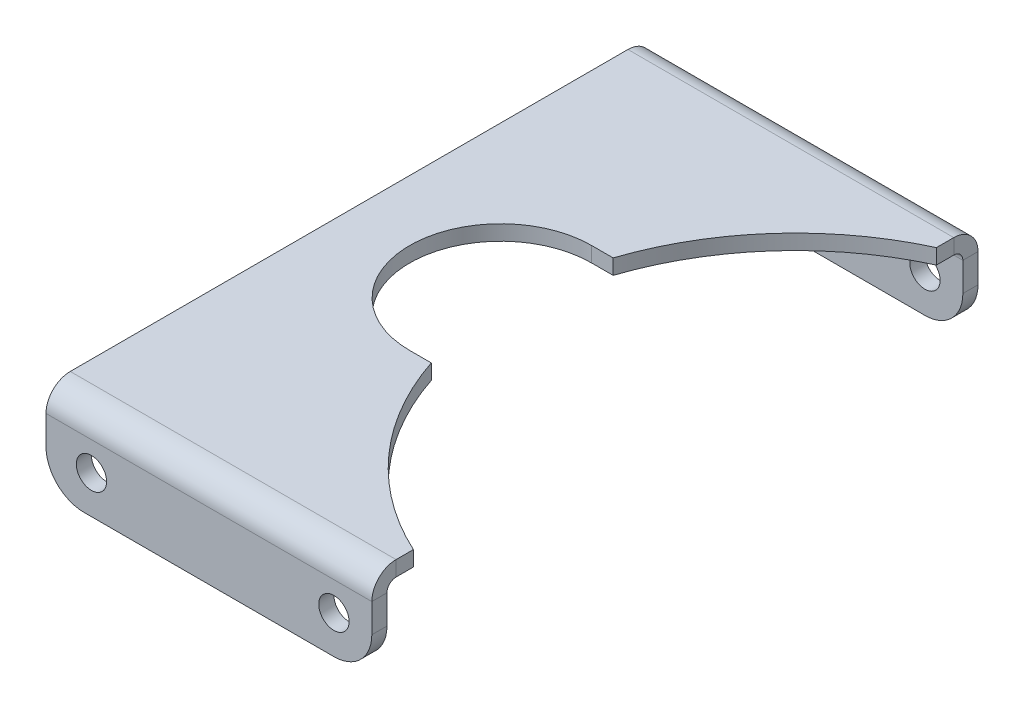
from build123d import *

# Parameters (mm, degrees)
EXTRUDE_THIN1_DEPTH    = 68.2625
SKETCH2_R              = 6.35
CUT_EXTRUDE1_DEPTH     = 266.758121054
FILLET1_R              = 15.875
CUT_EXTRUDE2_DEPTH     = 150.132085435
CONVERT_SOLID1_START   = -68.2625
CONVERT_SOLID1_DEPTH   = 136.525
CONVERT_SOLID1_2_DEPTH = 136.525
SKETCH8_R              = 120.65
CUT_EXTRUDE3_DEPTH     = 150.132085435


# Read off the part's stored shape, not the designer's step: Convert-Solid1
with BuildPart() as part:
    # Sketch1 → Extrude-Thin1 (new, symmetric)
    with BuildSketch(Plane(origin=(0, 0, 0), x_dir=(0, 0, -1), z_dir=(1, 0, 0))):
        Polygon((-127, -38.1), (-127, 0), (127, 0), (127, -38.1), (120.65, -38.1), (120.65, -6.35), (-120.65, -6.35), (-120.65, -38.1), align=None)
    extrude(amount=EXTRUDE_THIN1_DEPTH, both=True)

    # Sketch2 → Cut-Extrude1 (cut, through all)
    with BuildSketch(Plane.XY.offset(127)):
        with Locations((-49.2125, -22.225)):
            Circle(SKETCH2_R)
        with Locations((52.3875, -22.225)):
            Circle(SKETCH2_R)
    extrude(amount=-CUT_EXTRUDE1_DEPTH, mode=Mode.SUBTRACT)

    # Fillet1
    fillet1_edges = [part.edges().sort_by_distance(p)[0] for p in [
        (68.2625, -38.1, -123.825),
        (-68.2625, -38.1, -123.825),
        (68.2625, -38.1, 123.825),
        (-68.2625, -38.1, 123.825),
    ]]
    fillet(fillet1_edges, radius=FILLET1_R)

    # Sketch3 → Cut-Extrude2 (cut, through all)
    with BuildSketch(Plane(origin=(0, 0, 0), x_dir=(1, 0, 0), z_dir=(0, 1, 0))):
        with BuildLine():
            Line((-4.7625, 38.1), (68.2625, 38.1))
            Line((68.2625, 38.1), (68.2625, -38.1))
            Line((68.2625, -38.1), (-4.7625, -38.1))
            ThreePointArc((-4.7625, -38.1), (-42.8625, 0), (-4.7625, 38.1))
        make_face()
    extrude(amount=-CUT_EXTRUDE2_DEPTH, mode=Mode.SUBTRACT)

    # Convert-Solid1 outline → Convert-Solid1 (cut)
    with BuildSketch(Plane.YZ.offset(CONVERT_SOLID1_START)):
        with BuildLine():
            Line((0, -127), (0, -116.84))
            ThreePointArc((0, -116.84), (-2.975795103, -124.024204897), (-10.16, -127))
            Line((-10.16, -127), (0, -127))
        make_face()
        with BuildLine():
            ThreePointArc((-10.16, 127), (-2.975795103, 124.024204897), (0, 116.84))
            Line((0, 116.84), (0, 127))
            Line((0, 127), (-10.16, 127))
        make_face()
    extrude(amount=CONVERT_SOLID1_DEPTH, mode=Mode.SUBTRACT)

    # Convert-Solid1 2 outline → Convert-Solid1 2 (add)
    with BuildSketch(Plane.YZ.offset(CONVERT_SOLID1_START)):
        with BuildLine():
            Line((-6.35, -120.65), (-6.35, -116.84))
            ThreePointArc((-6.35, -116.84), (-7.465923164, -119.534076836), (-10.16, -120.65))
            Line((-10.16, -120.65), (-6.35, -120.65))
        make_face()
        with BuildLine():
            ThreePointArc((-10.16, 120.65), (-7.465923164, 119.534076836), (-6.35, 116.84))
            Line((-6.35, 116.84), (-6.35, 120.65))
            Line((-6.35, 120.65), (-10.16, 120.65))
        make_face()
    extrude(amount=CONVERT_SOLID1_2_DEPTH)

    # Sketch8 → Cut-Extrude3 (cut, through all)
    with BuildSketch(Plane(origin=(0, 0, 0), x_dir=(1, 0, 0), z_dir=(0, 1, 0))):
        with Locations((118.745, 0)):
            Circle(SKETCH8_R)
    extrude(amount=-CUT_EXTRUDE3_DEPTH, mode=Mode.SUBTRACT)


solid = part.part
